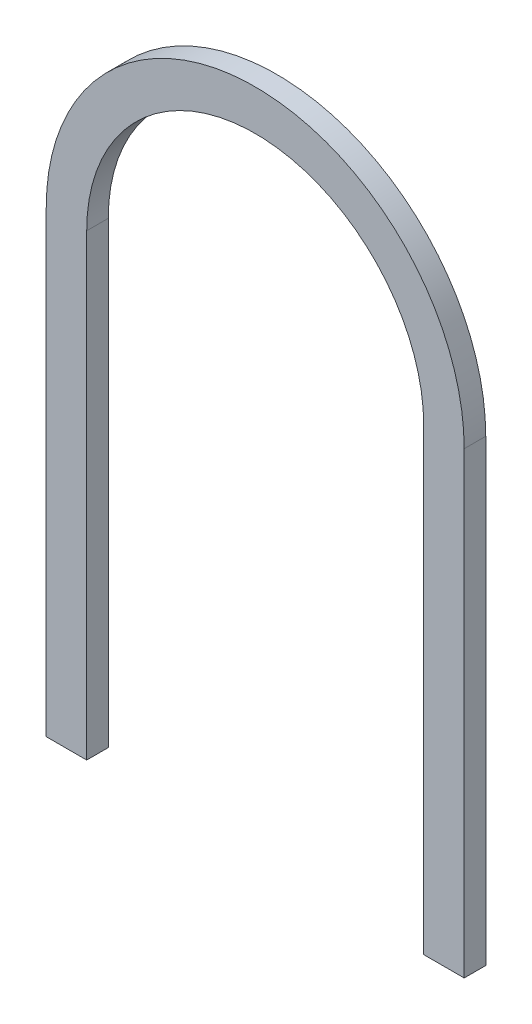
from build123d import *

# Parameters (mm, degrees)
SKETCH1_W           = 150
SKETCH1_H           = 160
BOSS_EXTRUDE1_DEPTH = 3.2
CUT_EXTRUDE1_REACH  = 111.705
CUT_EXTRUDE2_REACH  = 111.705


with BuildPart() as part:
    # Sketch1 → Boss-Extrude1 (new body)
    with BuildSketch(Plane.XY):
        Rectangle(SKETCH1_W, SKETCH1_H)
    extrude(amount=BOSS_EXTRUDE1_DEPTH)

    # Sketch2 → Cut-Extrude1 (cut, up to next)
    with BuildSketch(Plane.XY.offset(3.2), mode=Mode.PRIVATE) as cut_extrude1_sk1:
        with BuildLine():
            Line((-25, -12), (-25, -80))
            Line((-25, -80), (25, -80))
            Line((25, -80), (25, -12))
            ThreePointArc((25, -12), (0, 13), (-25, -12))
        make_face()
    cut_extrude1_tool1 = extrude(cut_extrude1_sk1.sketch, amount=-CUT_EXTRUDE1_REACH, mode=Mode.PRIVATE) & part.part
    add(cut_extrude1_tool1.solids().sort_by_distance((0, -36.004881, 3.2))[0], mode=Mode.SUBTRACT)

    # Sketch3 → Cut-Extrude2 (cut, up to next)
    with BuildSketch(Plane.XY.offset(3.2), mode=Mode.PRIVATE) as cut_extrude2_sk1:
        with BuildLine():
            Line((-31, -12), (-31, -80))
            Line((-31, -80), (-75, -80))
            Line((-75, -80), (-75, 80))
            Line((-75, 80), (75, 80))
            Line((75, 80), (75, -80))
            Line((75, -80), (31, -80))
            Line((31, -80), (31, -12))
            ThreePointArc((31, -12), (0, 19), (-31, -12))
        make_face()
    cut_extrude2_tool1 = extrude(cut_extrude2_sk1.sketch, amount=-CUT_EXTRUDE2_REACH, mode=Mode.PRIVATE) & part.part
    add(cut_extrude2_tool1.solids().sort_by_distance((-33.193171, -46, 3.2))[0], mode=Mode.SUBTRACT)


solid = part.part
